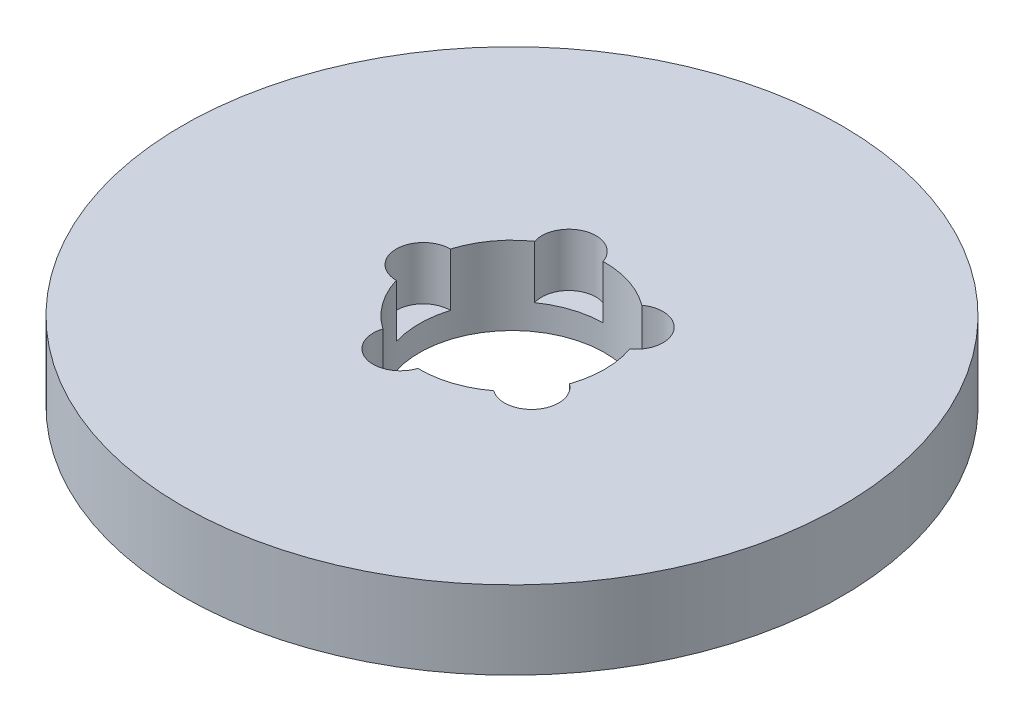
from build123d import *

# Parameters (mm, degrees)
SKETCH1_R           = 80
BOSS_EXTRUDE1_DEPTH = 19
SKETCH2_R           = 22.5
CUT_EXTRUDE1_DEPTH  = 115.721401665
SKETCH3_R           = 6.580979797
CUT_EXTRUDE2_DEPTH  = 12.899257244
CIRPATTERN1_COUNT   = 5


with BuildPart() as part:
    # Sketch1 → Boss-Extrude1 (new body)
    with BuildSketch(Plane(origin=(0, 0, 0), x_dir=(1, 0, 0), z_dir=(0, 1, 0))):
        Circle(SKETCH1_R)
    extrude(amount=BOSS_EXTRUDE1_DEPTH)

    # Sketch2 → Cut-Extrude1 (cut, through all)
    with BuildSketch(Plane(origin=(0, 0, 0), x_dir=(1, 0, 0), z_dir=(0, 1, 0))):
        Circle(SKETCH2_R)
    extrude(amount=CUT_EXTRUDE1_DEPTH, mode=Mode.SUBTRACT)

    # Sketch3 → Cut-Extrude2 (cut)
    with BuildSketch(Plane(origin=(0, 19, 0), x_dir=(1, 0, 0), z_dir=(0, 1, 0))):
        with Locations((-21.524179489, 0)):
            Circle(SKETCH3_R)
    cut_extrude2 = extrude(amount=-CUT_EXTRUDE2_DEPTH, mode=Mode.SUBTRACT)

    # CirPattern1: Cut-Extrude2 ×5 about axis
    cirpattern1_axis = Axis((0, 0, 0), (0, 1, 0))
    for i in range(1, CIRPATTERN1_COUNT):
        add(cut_extrude2.rotate(cirpattern1_axis, i * 360 / CIRPATTERN1_COUNT), mode=Mode.SUBTRACT)


solid = part.part
